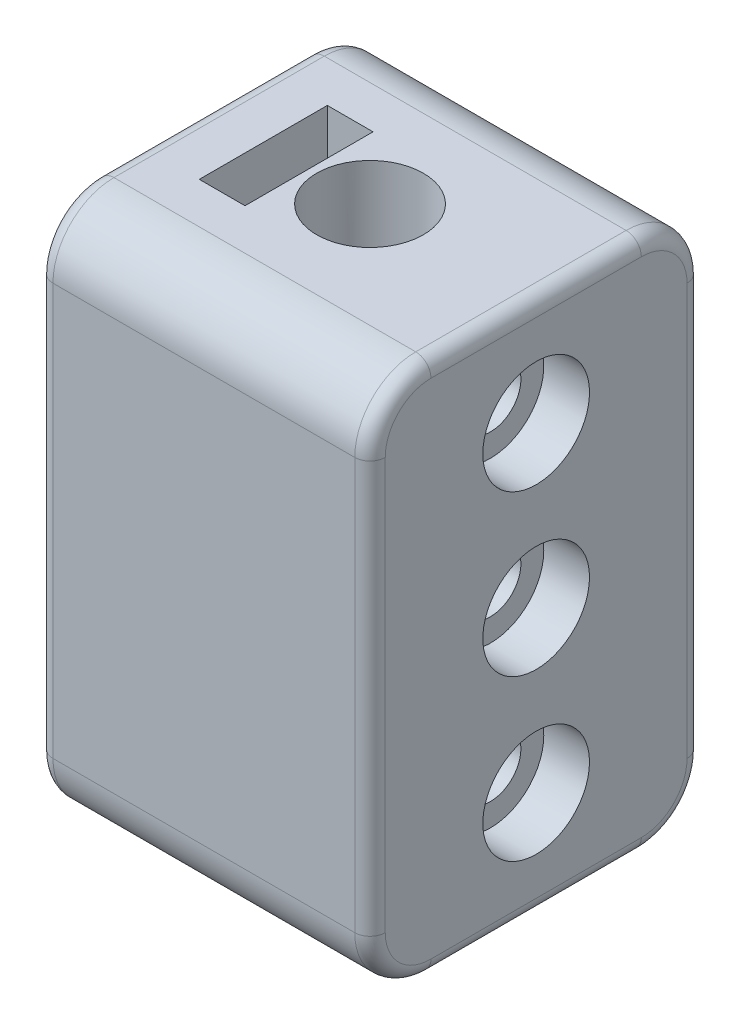
from build123d import *

# Parameters (mm, degrees)
CROQUIS1_W              = 21.8
CROQUIS1_H              = 35
SALIENTE_EXTRUIR1_DEPTH = 21.8
CROQUIS6_R              = 2
CORTAR_EXTRUIR2_DEPTH   = 21.8
REDONDEO2_R             = 1
REDONDEO3_R             = 4
CROQUIS7_R              = 3.5
CORTAR_EXTRUIR3_DEPTH   = 3
CORTAR_EXTRUIR4_REACH   = 48.642
CROQUIS11_R             = 3.5
CROQUIS11_W             = 3
CROQUIS11_H             = 8.4
MATRIZL1_COUNT          = 2
MATRIZL1_PITCH          = 18.8
CROQUIS14_W             = 3
CROQUIS14_H             = 8.4
SALIENTE_EXTRUIR2_DEPTH = 20
CROQUIS15_W             = 3
CROQUIS15_H             = 8.4
SALIENTE_EXTRUIR3_DEPTH = 20


with BuildPart() as part:
    # Croquis1 → Saliente-Extruir1 (new body)
    with BuildSketch(Plane(origin=(0, 0, 0), x_dir=(0, 0, -1), z_dir=(1, 0, 0))):
        with Locations((-10.9, -17.5)):
            Rectangle(CROQUIS1_W, CROQUIS1_H)
    extrude(amount=SALIENTE_EXTRUIR1_DEPTH)

    # Croquis6 → Cortar-Extruir2 (cut)
    with BuildSketch(Plane.ZY):
        with Locations((10.9, -28)):
            Circle(CROQUIS6_R)
        with Locations((10.9, -17.5)):
            Circle(CROQUIS6_R)
        with Locations(Location((10.9, -7, 0), (0, 0, 180))):
            Circle(CROQUIS6_R)
    extrude(amount=-CORTAR_EXTRUIR2_DEPTH, mode=Mode.SUBTRACT)

    # Redondeo2
    redondeo2_edges = [part.edges().sort_by_distance(p)[0] for p in [
        (21.8, -35, 10.9),
        (21.8, -17.5, 0),
        (21.8, 0, 10.9),
        (0, -17.5, 0),
        (0, -35, 10.9),
        (0, -17.5, 21.8),
        (0, 0, 10.9),
        (21.8, -17.5, 21.8),
    ]]
    fillet(redondeo2_edges, radius=REDONDEO2_R)

    # Redondeo3
    # the kernel refuses this fillet: 4 mm, written as the material it takes off along each edge
    with BuildSketch(Plane(origin=(0, -4, 4), x_dir=(0, 1, 0), z_dir=(0, 0, 1))) as redondeo3_piece_1:
        with BuildLine():
            CenterArc((3, -1), 1, 0, 90)
            Line((4, -1), (4, 0))
            Line((4, 0), (3, 0))
        make_face()
    revolve(axis=Axis((0, -4, 4), (-1, 0, 0)), revolution_arc=90, mode=Mode.SUBTRACT)
    with BuildSketch(Plane(origin=(0, -31, 4), x_dir=(0, 0, -1), z_dir=(0, 1, 0))) as redondeo3_piece_2:
        with BuildLine():
            CenterArc((3, -1), 1, 0, 90)
            Line((4, -1), (4, 0))
            Line((4, 0), (3, 0))
        make_face()
    revolve(axis=Axis((0, -31, 4), (-1, 0, 0)), revolution_arc=90, mode=Mode.SUBTRACT)
    with BuildSketch(Plane(origin=(0, -4, 17.8), x_dir=(0, 0, 1), z_dir=(0, -1, 0))) as redondeo3_piece_3:
        with BuildLine():
            CenterArc((3, -1), 1, 0, 90)
            Line((4, -1), (4, 0))
            Line((4, 0), (3, 0))
        make_face()
    revolve(axis=Axis((0, -4, 17.8), (-1, 0, 0)), revolution_arc=90, mode=Mode.SUBTRACT)
    with BuildSketch(Plane(origin=(0, -31, 17.8), x_dir=(0, -1, 0), z_dir=(0, 0, -1))) as redondeo3_piece_4:
        with BuildLine():
            CenterArc((3, -1), 1, 0, 90)
            Line((4, -1), (4, 0))
            Line((4, 0), (3, 0))
        make_face()
    revolve(axis=Axis((0, -31, 17.8), (-1, 0, 0)), revolution_arc=90, mode=Mode.SUBTRACT)
    with BuildSketch(Plane(origin=(21.8, -4, 4), x_dir=(0, 0, -1), z_dir=(0, -1, 0))) as redondeo3_piece_5:
        with BuildLine():
            CenterArc((3, -1), 1, 0, 90)
            Line((4, -1), (4, 0))
            Line((4, 0), (3, 0))
        make_face()
    revolve(axis=Axis((21.8, -4, 4), (1, 0, 0)), revolution_arc=90, mode=Mode.SUBTRACT)
    with BuildSketch(Plane(origin=(21.8, -31, 4), x_dir=(0, -1, 0), z_dir=(0, 0, 1))) as redondeo3_piece_6:
        with BuildLine():
            CenterArc((3, -1), 1, 0, 90)
            Line((4, -1), (4, 0))
            Line((4, 0), (3, 0))
        make_face()
    revolve(axis=Axis((21.8, -31, 4), (1, 0, 0)), revolution_arc=90, mode=Mode.SUBTRACT)
    with BuildSketch(Plane(origin=(21.8, -4, 17.8), x_dir=(0, 1, 0), z_dir=(0, 0, -1))) as redondeo3_piece_7:
        with BuildLine():
            CenterArc((3, -1), 1, 0, 90)
            Line((4, -1), (4, 0))
            Line((4, 0), (3, 0))
        make_face()
    revolve(axis=Axis((21.8, -4, 17.8), (1, 0, 0)), revolution_arc=90, mode=Mode.SUBTRACT)
    with BuildSketch(Plane(origin=(21.8, -31, 17.8), x_dir=(0, 0, 1), z_dir=(0, 1, 0))) as redondeo3_piece_8:
        with BuildLine():
            CenterArc((3, -1), 1, 0, 90)
            Line((4, -1), (4, 0))
            Line((4, 0), (3, 0))
        make_face()
    revolve(axis=Axis((21.8, -31, 17.8), (1, 0, 0)), revolution_arc=90, mode=Mode.SUBTRACT)
    with BuildSketch(Plane(origin=(0, -35, 21.8), x_dir=(0, 1, 0), z_dir=(1, 0, 0)), Plane(origin=(0, 0, 21.8), x_dir=(0, 0, -1), z_dir=(1, 0, 0))) as redondeo3_piece_9:
        with BuildLine():
            CenterArc((REDONDEO3_R, -REDONDEO3_R), REDONDEO3_R, 90, 90)
            Line((0, -REDONDEO3_R), (0, 0))
            Line((0, 0), (REDONDEO3_R, 0))
        make_face()
    extrude(amount=21.8, mode=Mode.SUBTRACT)
    with BuildSketch(Plane(origin=(0, 0, 0), x_dir=(0, 0, 1), z_dir=(1, 0, 0)), Plane(origin=(0, -35, 0), x_dir=(0, 1, 0), z_dir=(1, 0, 0))) as redondeo3_piece_10:
        with BuildLine():
            CenterArc((REDONDEO3_R, REDONDEO3_R), REDONDEO3_R, 180, 90)
            Line((0, REDONDEO3_R), (0, 0))
            Line((0, 0), (REDONDEO3_R, 0))
        make_face()
    extrude(amount=21.8, mode=Mode.SUBTRACT)

    # Croquis7 → Cortar-Extruir3 (cut)
    with BuildSketch(Plane(origin=(21.8, 0, 0), x_dir=(0, 0, -1), z_dir=(1, 0, 0))):
        with Locations((-10.9, -28)):
            Circle(CROQUIS7_R)
        with Locations((-10.9, -17.5)):
            Circle(CROQUIS7_R)
        with Locations(Location((-10.9, -7, 0), (0, 0, 180))):
            Circle(CROQUIS7_R)
    cortar_extruir3 = extrude(amount=-CORTAR_EXTRUIR3_DEPTH, mode=Mode.SUBTRACT)

    # Croquis11 → Cortar-Extruir4 (cut, up to next)
    with BuildSketch(Plane.XZ.offset(35), mode=Mode.PRIVATE) as cortar_extruir4_sk1:
        with Locations(Location((10.9, 10.9, 0), (0, 0, 270))):
            Circle(CROQUIS11_R)
    cortar_extruir4_tool1 = extrude(cortar_extruir4_sk1.sketch, amount=-CORTAR_EXTRUIR4_REACH, mode=Mode.PRIVATE) & part.part
    # Croquis11 → Cortar-Extruir4 (cut, up to next)
    with BuildSketch(Plane.XZ.offset(35), mode=Mode.PRIVATE) as cortar_extruir4_sk2:
        with Locations((5.4, 10.9)):
            Rectangle(CROQUIS11_W, CROQUIS11_H)
    cortar_extruir4_tool2 = extrude(cortar_extruir4_sk2.sketch, amount=-CORTAR_EXTRUIR4_REACH, mode=Mode.PRIVATE) & part.part
    # Croquis11 → Cortar-Extruir4 (cut, up to next)
    with BuildSketch(Plane.XZ.offset(35), mode=Mode.PRIVATE) as cortar_extruir4_sk3:
        with Locations((16.4, 10.9)):
            Rectangle(CROQUIS11_W, CROQUIS11_H)
    cortar_extruir4_tool3 = extrude(cortar_extruir4_sk3.sketch, amount=-CORTAR_EXTRUIR4_REACH, mode=Mode.PRIVATE) & part.part
    add(cortar_extruir4_tool1.solids().sort_by_distance((10.9, -35, 10.9))[0], mode=Mode.SUBTRACT)
    add(cortar_extruir4_tool2.solids().sort_by_distance((5.4, -35, 10.9))[0], mode=Mode.SUBTRACT)
    add(cortar_extruir4_tool3.solids().sort_by_distance((16.4, -35, 10.9))[0], mode=Mode.SUBTRACT)

    # MatrizL1: Cortar-Extruir3 ×2
    with Locations(*[(-i * MATRIZL1_PITCH, 0, 0) for i in range(1, MATRIZL1_COUNT)]):
        add(cortar_extruir3, mode=Mode.SUBTRACT)

    # Croquis14 → Saliente-Extruir2 (add)
    with BuildSketch(Plane(origin=(0, 0, 0), x_dir=(1, 0, 0), z_dir=(0, 1, 0))):
        with Locations((16.4, -10.9)):
            Rectangle(CROQUIS14_W, CROQUIS14_H)
    extrude(amount=-SALIENTE_EXTRUIR2_DEPTH)

    # Croquis15 → Saliente-Extruir3 (add)
    with BuildSketch(Plane.XZ.offset(35)):
        with Locations((5.4, 10.9)):
            Rectangle(CROQUIS15_W, CROQUIS15_H)
    extrude(amount=-SALIENTE_EXTRUIR3_DEPTH)


solid = part.part
